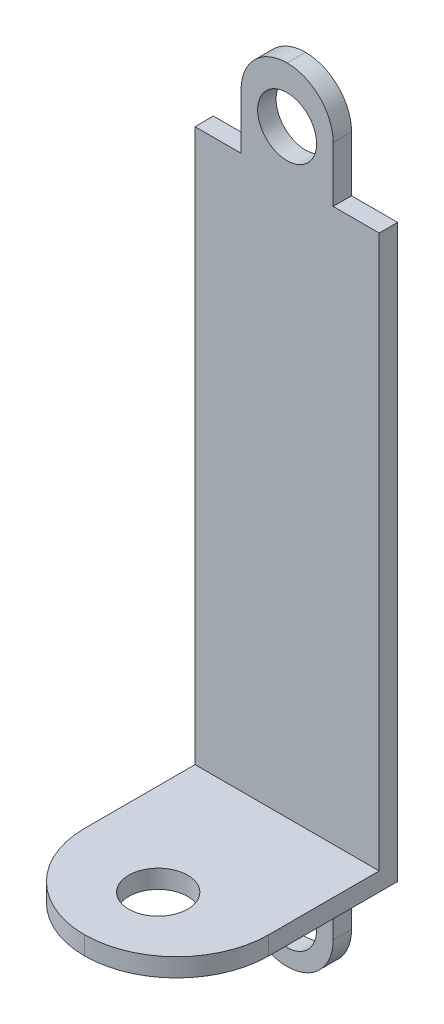
from build123d import *

# Parameters (mm, degrees)
SKETCH1_W           = 10
SKETCH1_H           = 36.5
BOSS_EXTRUDE1_DEPTH = 12
SKETCH2_W           = 11
SKETCH2_H           = 35.5
CUT_EXTRUDE1_DEPTH  = 34.725476075
SKETCH3_R           = 1.6
CUT_EXTRUDE2_DEPTH  = 16.77
SKETCH4_R           = 1.6
CUT_EXTRUDE4_DEPTH  = 16.77
FILLET1_R           = 5
FILLET2_R           = 5
SKETCH8_W           = 5
SKETCH8_H           = 1
BOSS_EXTRUDE2_DEPTH = 6
FILLET6_R           = 2.5
SKETCH9_R           = 1.6
CUT_EXTRUDE6_DEPTH  = 1
SKETCH10_W          = 2.5
SKETCH10_H          = 5.5
CUT_EXTRUDE7_DEPTH  = 1
FILLET7_R           = 2.5


with BuildPart() as part:
    # Sketch1 → Boss-Extrude1 (new body)
    with BuildSketch(Plane.XY):
        with Locations((-13.157195709, -11.639927007)):
            Rectangle(SKETCH1_W, SKETCH1_H)
    extrude(amount=BOSS_EXTRUDE1_DEPTH)

    # Sketch2 → Cut-Extrude1 (cut, through all)
    with BuildSketch(Plane.ZY.offset(18.157195709)):
        with Locations((6.5, -11.139927007)):
            Rectangle(SKETCH2_W, SKETCH2_H)
    extrude(amount=-CUT_EXTRUDE1_DEPTH, mode=Mode.SUBTRACT)

    # Sketch3 → Cut-Extrude2 (cut)
    with BuildSketch(Plane.XY.offset(1)):
        with Locations((-13.157195709, 3.610072993)):
            Circle(SKETCH3_R)
    extrude(amount=-CUT_EXTRUDE2_DEPTH, mode=Mode.SUBTRACT)

    # Sketch4 → Cut-Extrude4 (cut)
    with BuildSketch(Plane(origin=(0, -28.889927007, 0), x_dir=(1, 0, 0), z_dir=(0, 1, 0))):
        with Locations(Location((-13.157195709, -8, 0), (0, 0, 270))):
            Circle(SKETCH4_R)
    extrude(amount=-CUT_EXTRUDE4_DEPTH, mode=Mode.SUBTRACT)

    # Fillet1
    fillet1_edges = [part.edges().sort_by_distance(p)[0] for p in [
        (-18.157195709, -29.389927007, 12),
    ]]
    fillet(fillet1_edges, radius=FILLET1_R)

    # Fillet2
    fillet2_edges = [part.edges().sort_by_distance(p)[0] for p in [
        (-8.157195709, -29.389927007, 12),
    ]]
    fillet(fillet2_edges, radius=FILLET2_R - 0.0001)  # a hair under: the kernel refuses the full size

    # Sketch8 → Boss-Extrude2 (add)
    with BuildSketch(Plane.XZ.offset(29.889927007)):
        with Locations((-13.157195709, 0.5)):
            Rectangle(SKETCH8_W, SKETCH8_H)
    extrude(amount=BOSS_EXTRUDE2_DEPTH)

    # Fillet6
    fillet6_edges = [part.edges().sort_by_distance(p)[0] for p in [
        (-15.657195709, -35.889927007, 0.5),
        (-10.657195709, -35.889927007, 0.5),
    ]]
    fillet(fillet6_edges, radius=FILLET6_R - 0.0001)  # a hair under: the kernel refuses the full size

    # Sketch9 → Cut-Extrude6 (cut)
    with BuildSketch(Plane.XY.offset(1)):
        with Locations((-13.157195709, -33.389927007)):
            Circle(SKETCH9_R)
    extrude(amount=-CUT_EXTRUDE6_DEPTH, mode=Mode.SUBTRACT)

    # Sketch10 → Cut-Extrude7 (cut)
    with BuildSketch(Plane(origin=(0, 0, 0), x_dir=(-1, 0, 0), z_dir=(0, 0, -1))):
        with Locations((9.407195709, 3.860072993)):
            Rectangle(SKETCH10_W, SKETCH10_H)
        with Locations((16.907195709, 3.860072993)):
            Rectangle(SKETCH10_W, SKETCH10_H)
    extrude(amount=-CUT_EXTRUDE7_DEPTH, mode=Mode.SUBTRACT)

    # Fillet7
    fillet7_edges = [part.edges().sort_by_distance(p)[0] for p in [
        (-10.657195709, 6.610072993, 0.5),
        (-15.657195709, 6.610072993, 0.5),
    ]]
    fillet(fillet7_edges, radius=FILLET7_R - 0.0001)  # a hair under: the kernel refuses the full size


solid = part.part
